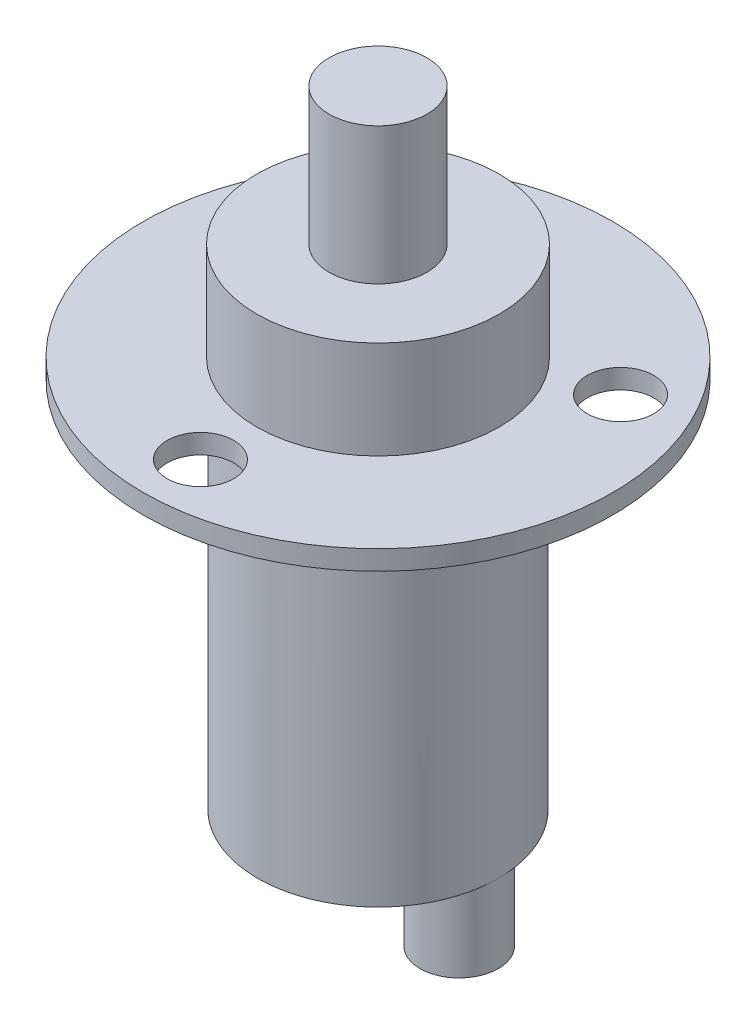
from build123d import *

# Parameters (mm, degrees)
SKETCH1_R            = 6.15
BOSS_EXTRUDE1_DEPTH  = 19
SKETCH2_R            = 12
BOSS_EXTRUDE2_DEPTH  = 1
SKETCH3_R            = 6.2
BOSS_EXTRUDE3_DEPTH  = 5
SKETCH4_R            = 2.5
BOSS_EXTRUDE4_DEPTH  = 7
SKETCH5_R            = 2
BOSS_EXTRUDE5_DEPTH  = 4
SKETCH6_R            = 1.5
CUT_EXTRUDE1_DEPTH   = 29.583211856
M3_CLEARANCE_HOLE1_D = 3.4


with BuildPart() as part:
    # Sketch1 → Boss-Extrude1 (new body)
    with BuildSketch(Plane(origin=(0, 0, 0), x_dir=(1, 0, 0), z_dir=(0, 1, 0))):
        Circle(SKETCH1_R)
    extrude(amount=BOSS_EXTRUDE1_DEPTH)

    # Sketch2 → Boss-Extrude2 (add)
    with BuildSketch(Plane(origin=(0, 19, 0), x_dir=(1, 0, 0), z_dir=(0, 1, 0))):
        Circle(SKETCH2_R)
    extrude(amount=BOSS_EXTRUDE2_DEPTH)

    # Sketch3 → Boss-Extrude3 (add)
    with BuildSketch(Plane(origin=(0, 20, 0), x_dir=(1, 0, 0), z_dir=(0, 1, 0))):
        Circle(SKETCH3_R)
    extrude(amount=BOSS_EXTRUDE3_DEPTH)

    # Sketch4 → Boss-Extrude4 (add)
    with BuildSketch(Plane(origin=(0, 25, 0), x_dir=(1, 0, 0), z_dir=(0, 1, 0))):
        Circle(SKETCH4_R)
    extrude(amount=BOSS_EXTRUDE4_DEPTH)

    # Sketch5 → Boss-Extrude5 (add)
    with BuildSketch(Plane.XZ):
        with Locations((-4.15, 0)):
            Circle(SKETCH5_R)
        with Locations((4.15, 0)):
            Circle(SKETCH5_R)
    extrude(amount=BOSS_EXTRUDE5_DEPTH)

    # Sketch6 → Cut-Extrude1 (cut, through all)
    with BuildSketch(Plane.XZ.offset(-19)):
        with Locations((0, 9.075)):
            Circle(SKETCH6_R)
        with Locations((7.859180539, -4.5375)):
            Circle(SKETCH6_R)
        with Locations((-7.859180539, -4.5375)):
            Circle(SKETCH6_R)
    extrude(amount=-CUT_EXTRUDE1_DEPTH, mode=Mode.SUBTRACT)

    # M3 Clearance Hole1 (through all)
    with Locations(Plane(origin=(0, 20, 0), x_dir=(1, 0, 0), z_dir=(0, 1, 0))):
        with Locations((7.859180539, 4.5375), (-7.859180539, 4.5375), (0, -9.075)):
            Hole(M3_CLEARANCE_HOLE1_D / 2)


solid = part.part
